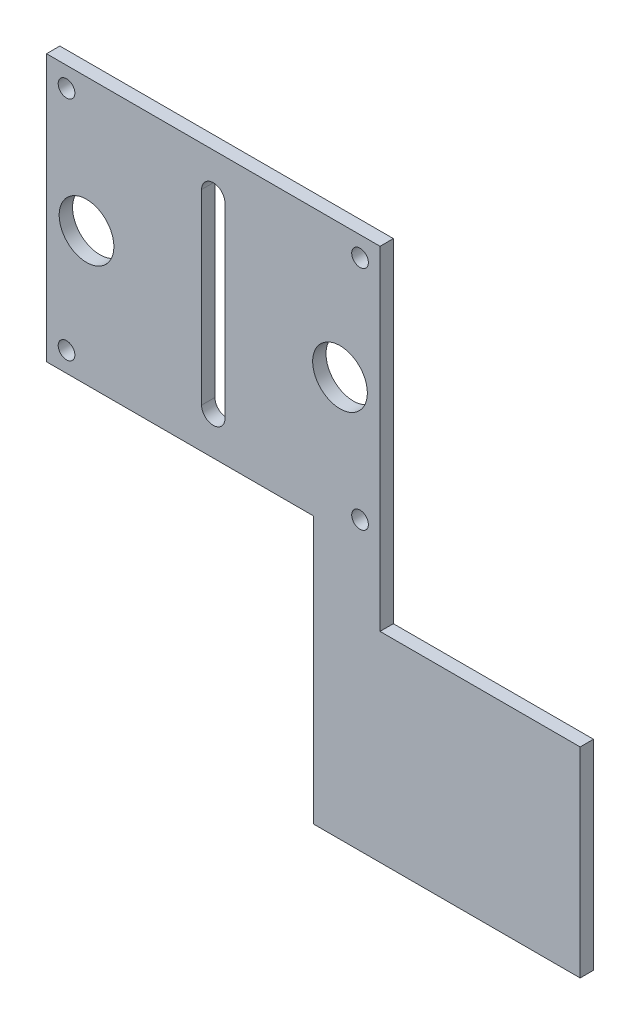
from build123d import *

# Parameters (mm, degrees)
PLATE_BODY_DEPTH     = 2
SKETCH2_R            = 4.1
SHAFT_BEARINGS_DEPTH = 90.465076985
SLOT_DEPTH           = 90.465076985
SKETCH5_R            = 1.25
BOLT_HOLES_DEPTH     = 90.465076985


with BuildPart() as part:
    # Sketch1 → plate_body (new body)
    with BuildSketch(Plane.XY):
        Polygon((0, 40), (0, 0), (40, 0), (40, -40), (80, -40), (80, -10), (50, -10), (50, 40), align=None)
    extrude(amount=PLATE_BODY_DEPTH)

    # Sketch2 → shaft_bearings (cut, through all)
    with BuildSketch(Plane.XY.offset(2)):
        with Locations((6, 20)):
            Circle(SKETCH2_R)
        with Locations((44, 20)):
            Circle(SKETCH2_R)
    extrude(amount=-SHAFT_BEARINGS_DEPTH, mode=Mode.SUBTRACT)

    # Sketch4 → slot (cut, through all)
    with BuildSketch(Plane.XY.offset(2)):
        with BuildLine():
            Line((26.75, 34), (26.75, 6))
            ThreePointArc((26.75, 6), (25, 4.25), (23.25, 6))
            Line((23.25, 6), (23.25, 34))
            ThreePointArc((23.25, 34), (25, 35.75), (26.75, 34))
        make_face()
    extrude(amount=-SLOT_DEPTH, mode=Mode.SUBTRACT)

    # Sketch5 → bolt_holes (cut, through all)
    with BuildSketch(Plane.XY.offset(2)):
        with Locations((3, 37)):
            Circle(SKETCH5_R)
        with Locations((47, 37)):
            Circle(SKETCH5_R)
        with Locations((3, 3)):
            Circle(SKETCH5_R)
        with Locations((47, 3)):
            Circle(SKETCH5_R)
    extrude(amount=-BOLT_HOLES_DEPTH, mode=Mode.SUBTRACT)


solid = part.part
